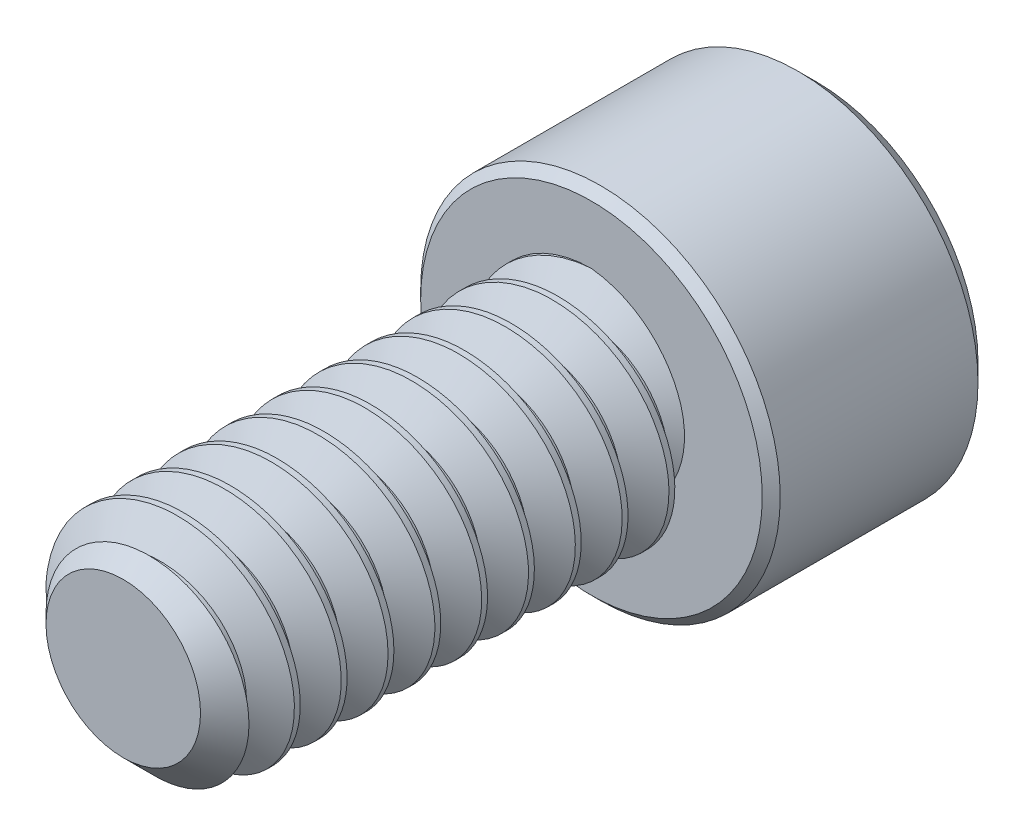
from build123d import *

# Parameters (mm, degrees)
SKETCH1_R          = 0.762
EXTRUDE1_DEPTH     = 3.175
CHAMFER3_SIZE      = 0.238125
CUT_SWEEP1_PITCH   = 0.3175
SKETCH6_R          = 1.2192
EXTRUDE2_DEPTH     = 1.524
CUT_EXTRUDE1_DEPTH = 0.9525
CHAMFER1_SIZE      = 0.12192
CHAMFER2_SIZE      = 0.06096


with BuildPart() as part:
    # Sketch1 → Extrude1 (new body)
    with BuildSketch(Plane.XY):
        Circle(SKETCH1_R)
    extrude(amount=-EXTRUDE1_DEPTH)

    # Chamfer3
    chamfer3_edges = [part.edges().sort_by_distance(p)[0] for p in [
        (-0.762, 0, 0),
    ]]
    chamfer(chamfer3_edges, length=CHAMFER3_SIZE)

    # Cut-Sweep1: the profile of Sketch3 profile screwed along a right-hand helix of 11 turns, 6 arcs to a turn; built about Z, then put on its axis
    cut_sweep1_z = Axis((0, 0, 0), (0, 0, 1))
    cut_sweep1_corners = [(0.7623, 0, -0.277985705), (0.555777701, 0, -0.15875), (0.555777701, 0, -0.1190625), (0.7623, 0, 0.000173205)]
    with BuildLine(mode=Mode.PRIVATE) as cut_sweep1_profile:
        Line(cut_sweep1_corners[0], cut_sweep1_corners[1])
        Line(cut_sweep1_corners[1], cut_sweep1_corners[2])
        Line(cut_sweep1_corners[2], cut_sweep1_corners[3])
        Line(cut_sweep1_corners[3], cut_sweep1_corners[0])
    cut_sweep1_cap = Face(cut_sweep1_profile.wire())
    cut_sweep1_turn_angles = [0, 30, 60, 90, 120, 150, 180, 210, 240, 270, 300, 330, 360]
    cut_sweep1_turn_weights = [1, 0.8660254037844387, 1, 0.8660254037844387, 1, 0.8660254037844387, 1, 0.8660254037844387, 1, 0.8660254037844387, 1, 0.8660254037844387, 1]
    cut_sweep1_turn_rails = [Edge.make_bspline([Vector(p[0], p[1], 0).rotate(cut_sweep1_z, cut_sweep1_turn_angles[k]) / cut_sweep1_turn_weights[k] + Vector(0, 0, p[2] + CUT_SWEEP1_PITCH * cut_sweep1_turn_angles[k] / 360) for k in range(13)], [0, 0, 0, 1, 1, 2, 2, 3, 3, 4, 4, 5, 5, 6, 6, 6], 2, cut_sweep1_turn_weights) for p in cut_sweep1_corners]
    cut_sweep1_turn_sides = [Face.make_surface_from_curves(cut_sweep1_turn_rails[p[0]], cut_sweep1_turn_rails[p[1]]) for p in [(0, 1), (1, 2), (2, 3), (3, 0)]]
    cut_sweep1 = Plane(origin=(0, 0, 0), x_dir=(0, 1, 0), z_dir=(0, 0, -1)) * Solid(Shell([*[p.moved(Location((0, 0, CUT_SWEEP1_PITCH * i))) for i in range(11) for p in cut_sweep1_turn_sides], cut_sweep1_cap, cut_sweep1_cap.rotate(cut_sweep1_z, 3960).moved(Location((0, 0, CUT_SWEEP1_PITCH * 3960 / 360)))]))
    add(cut_sweep1, mode=Mode.SUBTRACT)

    # Sketch6 → Extrude2 (add)
    with BuildSketch(Plane(origin=(0, 0, -3.175), x_dir=(-1, 0, 0), z_dir=(0, 0, -1))):
        with Locations(Location((0, 0, 0), (0, 0, 180))):
            Circle(SKETCH6_R)
    extrude(amount=EXTRUDE2_DEPTH)

    # Sketch7 → Cut-Extrude1 (cut)
    with BuildSketch(Plane(origin=(0, 0, -4.699), x_dir=(-1, 0, 0), z_dir=(0, 0, -1))):
        Polygon((0, 0.733234842), (-0.635, 0.366617421), (-0.635, -0.366617421), (0, -0.733234842), (0.635, -0.366617421), (0.635, 0.366617421), align=None)
    extrude(amount=-CUT_EXTRUDE1_DEPTH, mode=Mode.SUBTRACT)

    # Cut-Extrude2 cone 1 section (through the dimple's axis) → Cut-Extrude2 (revolve, cut)
    with BuildSketch(Plane(origin=(0, 0, -4.699), x_dir=(0, 1, 0), z_dir=(1, 0, 0))):
        Polygon((0, 0), (0.733234842, 0), (0, 0.733234842), align=None)
    revolve(axis=Axis((0, 0, -4.699), (0, 0, 1)), mode=Mode.SUBTRACT)

    # Chamfer1
    chamfer1_edges = [part.edges().sort_by_distance(p)[0] for p in [
        (-1.2192, 0, -4.699),
    ]]
    chamfer(chamfer1_edges, length=CHAMFER1_SIZE)

    # Chamfer2
    chamfer2_edges = [part.edges().sort_by_distance(p)[0] for p in [
        (-1.2192, 0, -3.175),
    ]]
    chamfer(chamfer2_edges, length=CHAMFER2_SIZE)


solid = part.part
